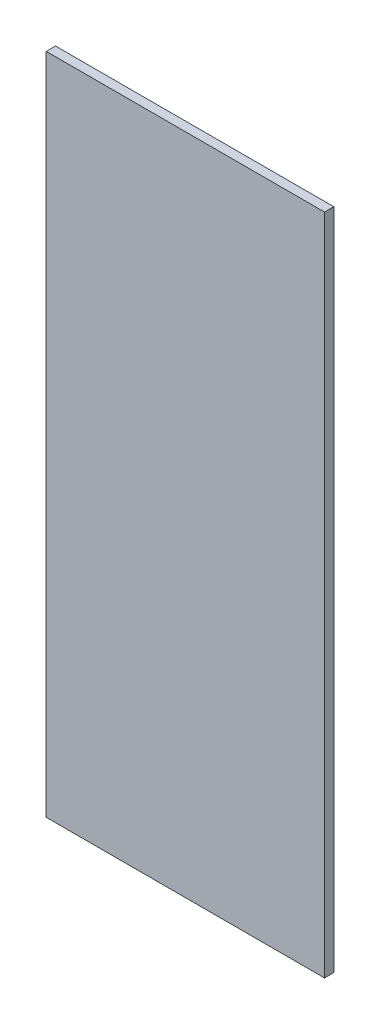
from build123d import *

# Parameters (mm, degrees)
SKETCH1_W          = 60
SKETCH1_H          = 143
BASE_FLANGE1_DEPTH = 2


# Sheet-metal steps are written as plain solids
with BuildPart() as part:
    # Sketch1 → Base-Flange1 (new body)
    with BuildSketch(Plane.XY):
        Rectangle(SKETCH1_W, SKETCH1_H)
    extrude(amount=-BASE_FLANGE1_DEPTH)


solid = part.part
